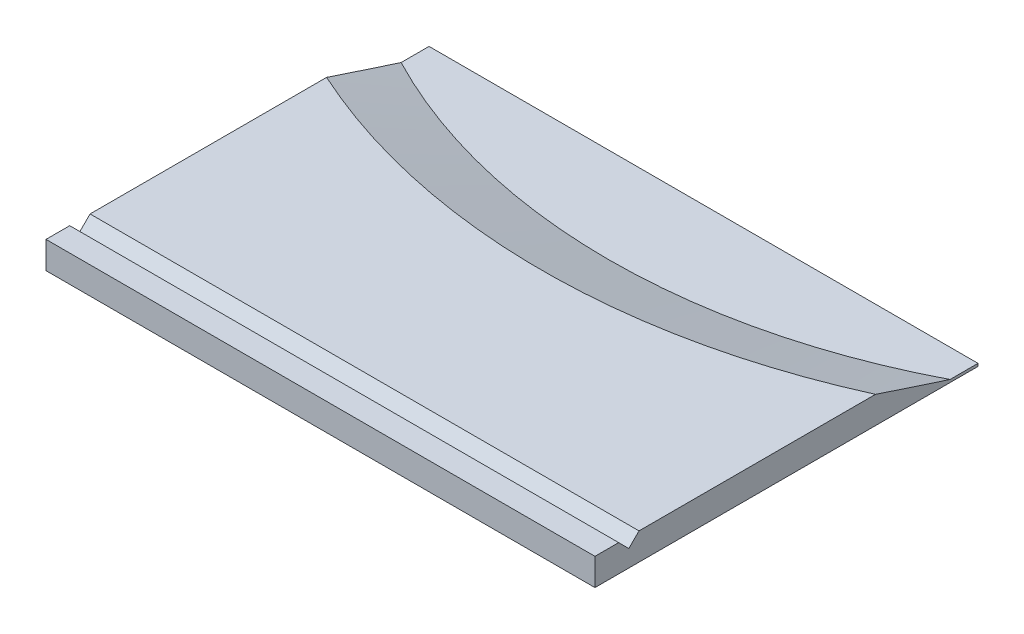
from build123d import *

# Parameters (mm, degrees)
SKETCH1_W           = 40.5
SKETCH1_H           = 28.26
BOSS_EXTRUDE1_DEPTH = 2
SKETCH2_R           = 44
CUT_EXTRUDE1_DEPTH  = 1.8
CHAMFER1_SIZE       = 4.945459355
CHAMFER1_SIZE_2     = 1.8
CUT_EXTRUDE2_DEPTH  = 43.940737069


with BuildPart() as part:
    # Sketch1 → Boss-Extrude1 (new body)
    with BuildSketch(Plane(origin=(0, 0, 0), x_dir=(1, 0, 0), z_dir=(0, 1, 0))):
        Rectangle(SKETCH1_W, SKETCH1_H)
    extrude(amount=BOSS_EXTRUDE1_DEPTH)

    # Sketch2 → Cut-Extrude1 (cut)
    with BuildSketch(Plane(origin=(0, 2, 0), x_dir=(1, 0, 0), z_dir=(0, 1, 0))):
        with Locations((0, 51.13)):
            Circle(SKETCH2_R)
    extrude(amount=-CUT_EXTRUDE1_DEPTH, mode=Mode.SUBTRACT)

    # Chamfer1
    # the kernel refuses this chamfer: 4.945459355, 1.8 mm, written as the material it takes off along each edge
    with BuildSketch(Plane(origin=(0, 2, -51.13), x_dir=(-0.6960446295726113, 0, 0.7179985192485611), z_dir=(-0.7179985192485611, 0, -0.6960446295726113))) as chamfer1_piece_1_section:
        Polygon((44 + CHAMFER1_SIZE, 0), (44, -CHAMFER1_SIZE_2), (44, 0), align=None)
    chamfer1_piece_1 = revolve(axis=Axis((0, 2, -51.13), (0, 1, 0)), revolution_arc=88.221038487, mode=Mode.PRIVATE)
    chamfer1_piece_1 = split(chamfer1_piece_1, bisect_by=Plane(origin=(0, 0.2, -4.588848893), z_dir=(0, 1, 0)), keep=Keep.TOP, mode=Mode.PRIVATE)
    add(chamfer1_piece_1, mode=Mode.SUBTRACT)

    # Sketch3 → Cut-Extrude2 (cut, through all)
    with BuildSketch(Plane(origin=(20.25, 0, 0), x_dir=(0, 0, -1), z_dir=(1, 0, 0))):
        Polygon((-12.38, 2), (-11.63, 1.25), (-10.88, 2), (-10.88, 3.484474426), (-12.38, 3.484474426), align=None)
    extrude(amount=-CUT_EXTRUDE2_DEPTH, mode=Mode.SUBTRACT)


solid = part.part
